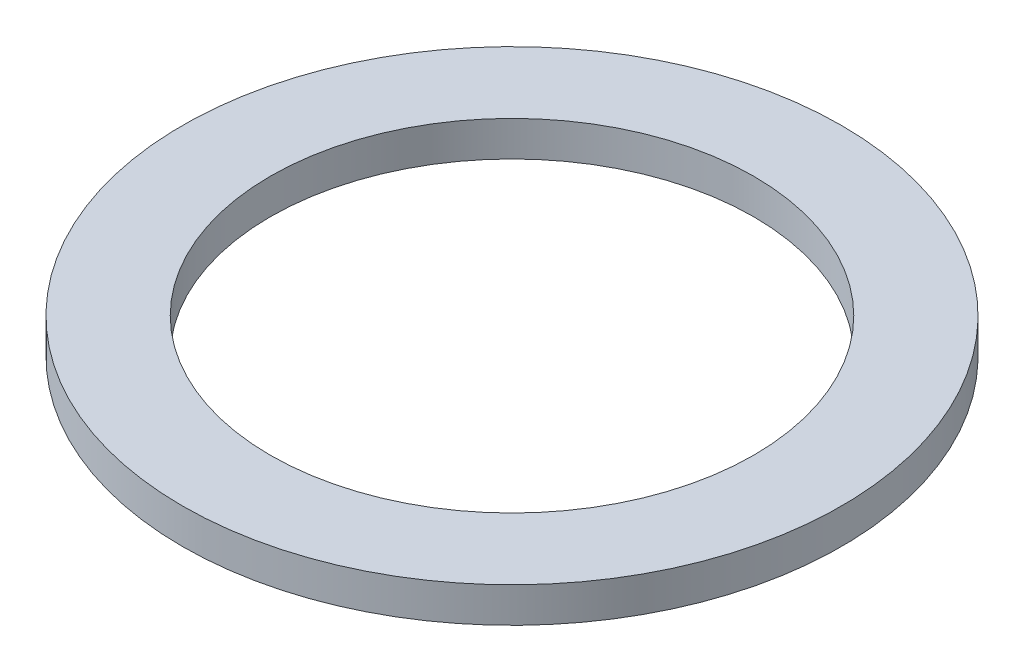
from build123d import *

# Parameters (mm, degrees)
SKETCH1_R           = 37.5
BOSS_EXTRUDE1_DEPTH = 4
SKETCH2_R           = 27.5
CUT_EXTRUDE1_DEPTH  = 54.183644102


with BuildPart() as part:
    # Sketch1 → Boss-Extrude1 (new body)
    with BuildSketch(Plane(origin=(0, 0, 0), x_dir=(1, 0, 0), z_dir=(0, 1, 0))):
        Circle(SKETCH1_R)
    extrude(amount=BOSS_EXTRUDE1_DEPTH)

    # Sketch2 → Cut-Extrude1 (cut, through all)
    with BuildSketch(Plane(origin=(0, 0, 0), x_dir=(1, 0, 0), z_dir=(0, 1, 0))):
        Circle(SKETCH2_R)
    extrude(amount=CUT_EXTRUDE1_DEPTH, mode=Mode.SUBTRACT)


solid = part.part
